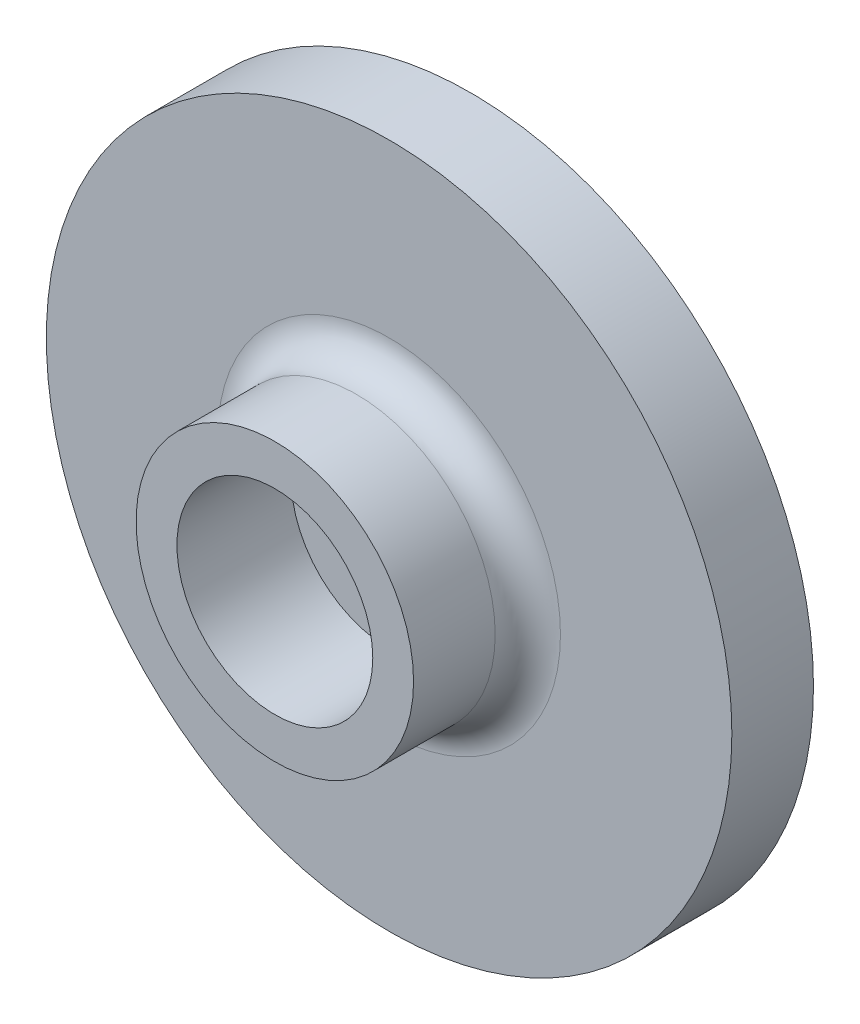
from build123d import *

# Parameters (mm, degrees)
SKETCH1_R           = 10.5
BOSS_EXTRUDE1_DEPTH = 2.5
SKETCH2_R           = 4.25
SKETCH2_R_2         = 3
BOSS_EXTRUDE2_DEPTH = 3.5
SKETCH2_3_R         = 1.5
CUT_EXTRUDE1_DEPTH  = 3.5
FILLET1_R           = 1
SKETCH3_R           = 3
CUT_EXTRUDE2_DEPTH  = 1


with BuildPart() as part:
    # Sketch1 → Boss-Extrude1 (new body)
    with BuildSketch(Plane.XY):
        Circle(SKETCH1_R)
    extrude(amount=BOSS_EXTRUDE1_DEPTH)

    # Sketch2 → Boss-Extrude2 (add)
    with BuildSketch(Plane.XY.offset(2.5)):
        Circle(SKETCH2_R)
        Circle(SKETCH2_R_2, mode=Mode.SUBTRACT)
    extrude(amount=BOSS_EXTRUDE2_DEPTH)

    # Sketch2<3> → Cut-Extrude1 (cut)
    with BuildSketch(Plane.XY.offset(2.5)):
        Circle(SKETCH2_3_R)
    extrude(amount=-CUT_EXTRUDE1_DEPTH, mode=Mode.SUBTRACT)

    # Fillet1
    fillet1_edges = [part.edges().sort_by_distance(p)[0] for p in [
        (-4.25, 0, 2.5),
    ]]
    fillet(fillet1_edges, radius=FILLET1_R)

    # Sketch3 → Cut-Extrude2 (cut)
    with BuildSketch(Plane(origin=(0, 0, 0), x_dir=(-1, 0, 0), z_dir=(0, 0, -1))):
        Circle(SKETCH3_R)
    extrude(amount=-CUT_EXTRUDE2_DEPTH, mode=Mode.SUBTRACT)


solid = part.part
